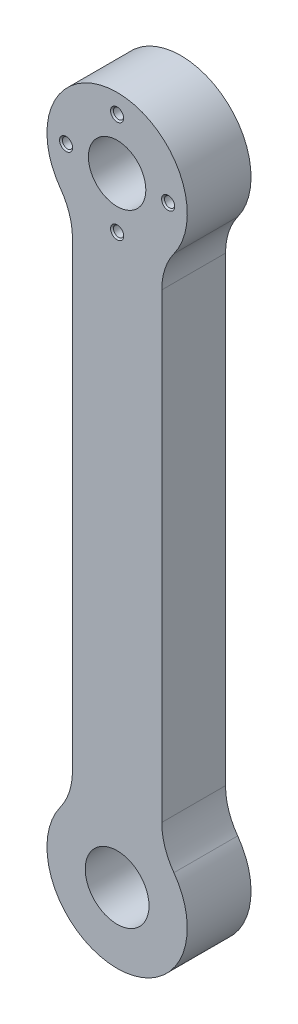
from build123d import *

# Parameters (mm, degrees)
ESQUISSE1_R                 = 4.502635458
BOSS_EXTRU_1_DEPTH          = 10
TROU_TARAUD_M22_D           = 1.6
TROU_TARAUD_M22_CSINK_D     = 2.05
TROU_TARAUD_M22_CSINK_ANGLE = 90
CONG_1_R                    = 10
ESQUISSE9_R                 = 5
ENL_V_MAT_EXTRU_1_DEPTH     = 10


with BuildPart() as part:
    # Esquisse1 → Boss.-Extru.1 (new body)
    with BuildSketch(Plane.XY):
        with BuildLine():
            Line((-7, 40), (-7, -40))
            ThreePointArc((-7, -40), (0, -59.485281374), (7, -40))
            Line((7, -40), (7, 40))
            ThreePointArc((7, 40), (0, 59.485281374), (-7, 40))
        make_face()
        with Locations((0, 48.485281374)):
            Circle(ESQUISSE1_R, mode=Mode.SUBTRACT)
    extrude(amount=BOSS_EXTRU_1_DEPTH)

    # Trou taraudé M22 (through all)
    with Locations(Plane.XY.offset(10)):
        with Locations((-8, 48.485281374), (0, 56.485281374), (8, 48.485281374), (0, 40.485281374)):
            CounterSinkHole(TROU_TARAUD_M22_D / 2, TROU_TARAUD_M22_CSINK_D / 2, counter_sink_angle=TROU_TARAUD_M22_CSINK_ANGLE)

    # Congé1
    cong_1_edges = [part.edges().sort_by_distance(p)[0] for p in [
        (-7, -40, 5),
        (7, -40, 5),
        (7, 40, 5),
        (-7, 40, 5),
    ]]
    fillet(cong_1_edges, radius=CONG_1_R)

    # Esquisse9 → Enlèv. mat.-Extru.1 (cut)
    with BuildSketch(Plane.XY.offset(10)):
        with Locations((0, -48.485281374)):
            Circle(ESQUISSE9_R)
    extrude(amount=-ENL_V_MAT_EXTRU_1_DEPTH, mode=Mode.SUBTRACT)


solid = part.part
